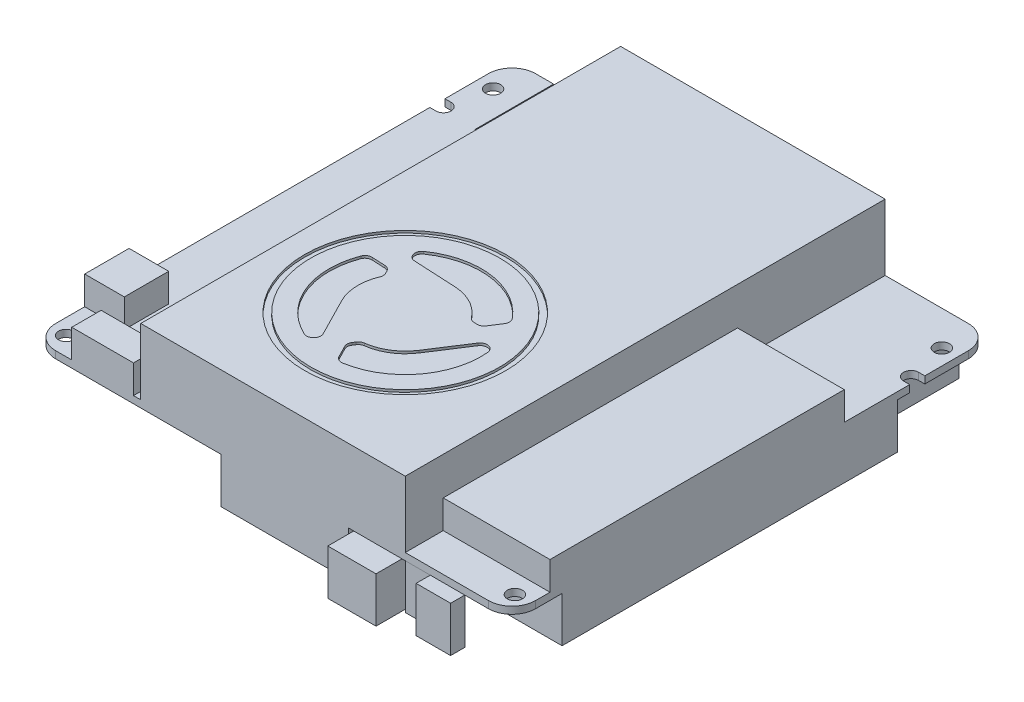
from build123d import *

# Parameters (mm, degrees)
SKETCH_1_R          = 1.6
EXTRUDE_1_DEPTH     = 1.5
SKETCH_2_W          = 56
SKETCH_2_H          = 101.6
EXTRUDE_2_DEPTH     = 14
SKETCH_3_W          = 22.6
SKETCH_3_H          = 62.30419098
SKETCH_3_W_2        = 13.073006245
SKETCH_3_H_2        = 6.218410599
SKETCH_3_W_3        = 8.391210828
SKETCH_3_H_3        = 9.399534429
EXTRUDE_3_DEPTH     = 6
SKETCH_4_W          = 6
SKETCH_4_H          = 11.3
EXTRUDE_4_DEPTH     = 13.4
SKETCH_5_W          = 1.75
SKETCH_5_H          = 8
CUT_EXTRUDE_1_DEPTH = 45
SKETCH_6_W          = 20
SKETCH_6_H          = 13
SKETCH_6_W_2        = 21
SKETCH_6_H_2        = 24
SKETCH_6_W_3        = 30
SKETCH_6_H_3        = 55
SKETCH_6_W_4        = 51
SKETCH_6_H_4        = 71
SKETCH_6_W_5        = 6.36
SKETCH_6_H_5        = 16
SKETCH_6_W_6        = 27
SKETCH_6_H_6        = 4
SKETCH_6_W_7        = 10.21
SKETCH_6_H_7        = 13.5
SKETCH_6_W_8        = 7.6
SKETCH_6_H_8        = 2.5
SKETCH_6_W_9        = 7.3
SKETCH_6_H_9        = 3
EXTRUDE_5_DEPTH     = 9.6
SKETCH_7_R          = 21.3
SKETCH_7_R_2        = 20
CUT_EXTRUDE_2_DEPTH = 0.5


with BuildPart() as part:
    # Эскиз1 → Бобышка-Вытянуть1 (new body)
    with BuildSketch(Plane(origin=(0, 0, 0), x_dir=(1, 0, 0), z_dir=(0, 1, 0))):
        with BuildLine():
            Line((-41.98741166, 50.8), (-45.8, 50.8))
            ThreePointArc((-45.8, 50.8), (-49.335533906, 49.335533906), (-50.8, 45.8))
            Line((-50.8, 45.8), (-50.8, 36.6))
            Line((-50.8, 36.6), (-49.5, 36.6))
            ThreePointArc((-49.5, 36.6), (-47.9, 35), (-49.5, 33.4))
            Line((-49.5, 33.4), (-50.8, 33.4))
            Line((-50.8, 33.4), (-50.8, -45.8))
            ThreePointArc((-50.8, -45.8), (-49.335533906, -49.335533906), (-45.8, -50.8))
            Line((-45.8, -50.8), (45.8, -50.8))
            ThreePointArc((45.8, -50.8), (49.335533906, -49.335533906), (50.8, -45.8))
            Line((50.8, -45.8), (50.8, 33.4))
            Line((50.8, 33.4), (49.5, 33.4))
            ThreePointArc((49.5, 33.4), (47.9, 35), (49.5, 36.6))
            Line((49.5, 36.6), (50.8, 36.6))
            Line((50.8, 36.6), (50.8, 45.8))
            ThreePointArc((50.8, 45.8), (49.335533906, 49.335533906), (45.8, 50.8))
            Line((45.8, 50.8), (-28.760333271, 50.8))
            Line((-28.760333271, 50.8), (-28.760333271, 34.113711923))
            Line((-28.760333271, 34.113711923), (-41.98741166, 34.113711923))
            Line((-41.98741166, 34.113711923), (-41.98741166, 50.8))
        make_face()
        with Locations((-47.5, -46.9)):
            Circle(SKETCH_1_R, mode=Mode.SUBTRACT)
        with Locations((47.5, -46.9)):
            Circle(SKETCH_1_R, mode=Mode.SUBTRACT)
        with Locations((-47.5, 43.5)):
            Circle(SKETCH_1_R, mode=Mode.SUBTRACT)
        with Locations((47.5, 43.5)):
            Circle(SKETCH_1_R, mode=Mode.SUBTRACT)
    extrude(amount=EXTRUDE_1_DEPTH)

    # Эскиз2 → Бобышка-Вытянуть2 (add)
    with BuildSketch(Plane(origin=(0, 1.5, 0), x_dir=(1, 0, 0), z_dir=(0, 1, 0))):
        with Locations((0.2, 0)):
            Rectangle(SKETCH_2_W, SKETCH_2_H)
    extrude(amount=EXTRUDE_2_DEPTH)

    # Эскиз3 → Бобышка-Вытянуть3 (add)
    with BuildSketch(Plane(origin=(0, 1.5, 0), x_dir=(1, 0, 0), z_dir=(0, 1, 0))):
        with Locations((39.5, -11.607082664)):
            Rectangle(SKETCH_3_W, SKETCH_3_H)
        with Locations((-35.87228605, -47.690794701)):
            Rectangle(SKETCH_3_W_2, SKETCH_3_H_2)
        with Locations((-46.604394586, -34.970831235)):
            Rectangle(SKETCH_3_W_3, SKETCH_3_H_3)
    extrude(amount=EXTRUDE_3_DEPTH)

    # Эскиз4 → Бобышка-Вытянуть4 (add)
    with BuildSketch(Plane.XZ):
        with Locations((27.8, -45.15)):
            Rectangle(SKETCH_4_W, SKETCH_4_H)
    extrude(amount=EXTRUDE_4_DEPTH)

    # Эскиз5 → Вырез-Вытянуть1 (cut)
    with BuildSketch(Plane(origin=(0, 0, -50.8), x_dir=(-1, 0, 0), z_dir=(0, 0, -1))):
        with Locations((-26.531274607, 11.4)):
            Rectangle(SKETCH_5_W, SKETCH_5_H)
        with Locations((-24.581274607, 11.4)):
            Rectangle(SKETCH_5_W, SKETCH_5_H)
        with Locations((-22.631274607, 11.4)):
            Rectangle(SKETCH_5_W, SKETCH_5_H)
        with Locations((-20.681274607, 11.4)):
            Rectangle(SKETCH_5_W, SKETCH_5_H)
        with Locations((-18.731274607, 11.4)):
            Rectangle(SKETCH_5_W, SKETCH_5_H)
        with Locations((-16.781274607, 11.4)):
            Rectangle(SKETCH_5_W, SKETCH_5_H)
        with Locations((-14.831274607, 11.4)):
            Rectangle(SKETCH_5_W, SKETCH_5_H)
        with Locations((-12.881274607, 11.4)):
            Rectangle(SKETCH_5_W, SKETCH_5_H)
        with Locations((-10.931274607, 11.4)):
            Rectangle(SKETCH_5_W, SKETCH_5_H)
        with Locations((-8.981274607, 11.4)):
            Rectangle(SKETCH_5_W, SKETCH_5_H)
        with Locations((-7.031274607, 11.4)):
            Rectangle(SKETCH_5_W, SKETCH_5_H)
        with Locations((-5.081274607, 11.4)):
            Rectangle(SKETCH_5_W, SKETCH_5_H)
        with Locations((-3.131274607, 11.4)):
            Rectangle(SKETCH_5_W, SKETCH_5_H)
        with Locations((-1.181274607, 11.4)):
            Rectangle(SKETCH_5_W, SKETCH_5_H)
        with Locations((0.768725393, 11.4)):
            Rectangle(SKETCH_5_W, SKETCH_5_H)
        with Locations((2.718725393, 11.4)):
            Rectangle(SKETCH_5_W, SKETCH_5_H)
        with Locations((4.668725393, 11.4)):
            Rectangle(SKETCH_5_W, SKETCH_5_H)
        with Locations((6.618725393, 11.4)):
            Rectangle(SKETCH_5_W, SKETCH_5_H)
        with Locations((8.568725393, 11.4)):
            Rectangle(SKETCH_5_W, SKETCH_5_H)
        with Locations((10.518725393, 11.4)):
            Rectangle(SKETCH_5_W, SKETCH_5_H)
        with Locations((12.468725393, 11.4)):
            Rectangle(SKETCH_5_W, SKETCH_5_H)
        with Locations((14.418725393, 11.4)):
            Rectangle(SKETCH_5_W, SKETCH_5_H)
        with Locations((16.368725393, 11.4)):
            Rectangle(SKETCH_5_W, SKETCH_5_H)
        with Locations((18.318725393, 11.4)):
            Rectangle(SKETCH_5_W, SKETCH_5_H)
        with Locations((20.268725393, 11.4)):
            Rectangle(SKETCH_5_W, SKETCH_5_H)
        with Locations((22.218725393, 11.4)):
            Rectangle(SKETCH_5_W, SKETCH_5_H)
        with Locations((24.168725393, 11.4)):
            Rectangle(SKETCH_5_W, SKETCH_5_H)
        with Locations((26.118725393, 11.4)):
            Rectangle(SKETCH_5_W, SKETCH_5_H)
    extrude(amount=-CUT_EXTRUDE_1_DEPTH, mode=Mode.SUBTRACT)

    # Эскиз6 → Бобышка-Вытянуть5 (add)
    with BuildSketch(Plane.XZ):
        with Locations((33.8, -44.3)):
            Rectangle(SKETCH_6_W, SKETCH_6_H)
        with Locations((-16.3, -38.8)):
            Rectangle(SKETCH_6_W_2, SKETCH_6_H_2)
        with Locations((-35.8, 4.7)):
            Rectangle(SKETCH_6_W_3, SKETCH_6_H_3)
        with Locations((25.3, 4.7)):
            Rectangle(SKETCH_6_W_4, SKETCH_6_H_4)
        with Locations((-6.98, 32.8)):
            Rectangle(SKETCH_6_W_5, SKETCH_6_H_5)
        with Locations((2.7, 48.8)):
            Rectangle(SKETCH_6_W_6, SKETCH_6_H_6)
        with Locations((22.405, 49.55)):
            Rectangle(SKETCH_6_W_7, SKETCH_6_H_7)
        with Locations((32, 49.45)):
            Rectangle(SKETCH_6_W_8, SKETCH_6_H_8)
        with Locations((37.15, 52.3)):
            Rectangle(SKETCH_6_W_9, SKETCH_6_H_9)
    extrude(amount=EXTRUDE_5_DEPTH)


with BuildPart() as extrude_5_piece_1:
    # of the separate pieces the step leaves, piece 1, a body of its own (extrude_5_pieces)
    add(part.part.solids().sort_by_distance((45.8, 0, -50.8))[0])

    # Эскиз7 → Вырез-Вытянуть2 (cut)
    # profile 1 of 4: a face of its own
    with BuildSketch(Plane(origin=(0, 15.5, 0), x_dir=(1, 0, 0), z_dir=(0, 1, 0))):
        with Locations((-1.8, -20.8)):
            Circle(SKETCH_7_R)
        with Locations((-1.8, -20.8)):
            Circle(SKETCH_7_R_2, mode=Mode.SUBTRACT)
    # profile 2 of 4: a face of its own
    with BuildSketch(Plane(origin=(0, 15.5, 0), x_dir=(1, 0, 0), z_dir=(0, 1, 0))):
        with BuildLine():
            Line((11.482581989, -18.682686676), (6.594839992, -26.233844082))
            ThreePointArc((6.594839992, -26.233844082), (3.528867865, -29.261865473), (-0.526626992, -30.718594718))
            ThreePointArc((-0.526626992, -30.718594718), (-1.134951221, -30.937104105), (-1.59484704, -31.391307314))
            Line((-1.59484704, -31.391307314), (-1.932142706, -31.912401239))
            ThreePointArc((-1.932142706, -31.912401239), (-2.170976717, -32.651213798), (-2.008406759, -33.410461249))
            Line((-2.008406759, -33.410461249), (-0.742616697, -35.885558067))
            ThreePointArc((-0.742616697, -35.885558067), (-0.082055182, -36.54215351), (0.838716508, -36.682291245))
            ThreePointArc((0.838716508, -36.682291245), (10.9344302, -30.651105902), (14.235829356, -19.363971845))
            ThreePointArc((14.235829356, -19.363971845), (13.10211284, -18.041679358), (11.482581989, -18.682686676))
        make_face()
    # profile 3 of 4: a face of its own
    with BuildSketch(Plane(origin=(0, 15.5, 0), x_dir=(1, 0, 0), z_dir=(0, 1, 0))):
        with BuildLine():
            Line((9.225183174, -14.675254923), (10.735784865, -12.341500164))
            ThreePointArc((10.735784865, -12.341500164), (10.974132441, -11.441139391), (10.635109435, -10.573658848))
            ThreePointArc((10.635109435, -10.573658848), (0.364092866, -4.846106993), (-11.061551541, -7.630578484))
            ThreePointArc((-11.061551541, -7.630578484), (-11.639832168, -9.273552031), (-10.274938121, -10.355603232))
            Line((-10.274938121, -10.355603232), (-1.291572981, -10.812933265))
            ThreePointArc((-1.291572981, -10.812933265), (2.863756531, -11.954132319), (6.153068492, -14.737929268))
            ThreePointArc((6.153068492, -14.737929268), (6.646465286, -15.15549881), (7.269764713, -15.326678668))
            Line((7.269764713, -15.326678668), (7.889693123, -15.358238321))
            ThreePointArc((7.889693123, -15.358238321), (8.648940574, -15.195668362), (9.225183174, -14.675254923))
        make_face()
    # profile 4 of 4: a face of its own
    with BuildSketch(Plane(origin=(0, 15.5, 0), x_dir=(1, 0, 0), z_dir=(0, 1, 0))):
        with BuildLine():
            ThreePointArc((-11.357550417, -15.12936044), (-11.877963856, -14.55311784), (-12.616776416, -14.314283828))
            Line((-12.616776416, -14.314283828), (-15.393168168, -14.172941768))
            ThreePointArc((-15.393168168, -14.172941768), (-16.292077259, -14.4167071), (-16.873825942, -15.144049907))
            ThreePointArc((-16.873825942, -15.144049907), (-16.698523066, -26.902787105), (-8.574277815, -35.405449671))
            ThreePointArc((-8.574277815, -35.405449671), (-6.862280672, -35.084768611), (-6.607643868, -33.361710092))
            Line((-6.607643868, -33.361710092), (-10.703267011, -25.353222653))
            ThreePointArc((-10.703267011, -25.353222653), (-11.792624395, -21.184002208), (-11.0264415, -16.943476014))
            ThreePointArc((-11.0264415, -16.943476014), (-10.911514065, -16.307397085), (-11.074917673, -15.682014018))
            Line((-11.074917673, -15.682014018), (-11.357550417, -15.12936044))
        make_face()
    extrude(amount=-CUT_EXTRUDE_2_DEPTH, mode=Mode.SUBTRACT)


with BuildPart() as extrude_5_piece_2:
    # of the separate pieces the step leaves, piece 2, a body of its own (extrude_5_pieces)
    add(part.part.solids().sort_by_distance((40.8, -9.6, 50.8))[0])


solid = Compound([extrude_5_piece_1.part, extrude_5_piece_2.part])
